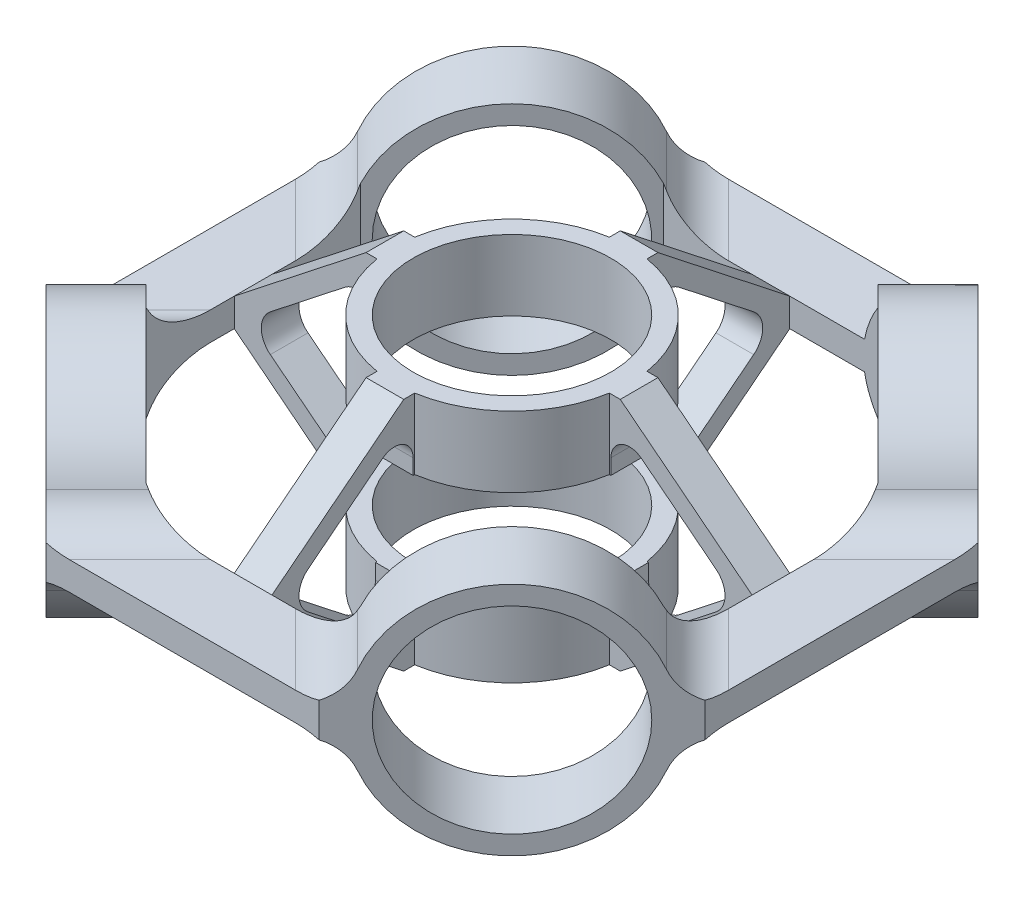
from build123d import *

# Parameters (mm, degrees)
EXTRUDE_START              = 25
SKETCH_1_R                 = 25
SKETCH_1_R_2               = 21
EXTRUDE_1_DEPTH            = 15
EXTRUDE_2_DEPTH            = 3
EXTRUDE_START_2            = -25
SKETCH_1_5_R               = 25
SKETCH_1_5_R_2             = 21
EXTRUDE_7_DEPTH            = 15
SKETCH_5_R                 = 25
SKETCH_5_R_2               = 21
EXTRUDE_9_DEPTH            = 20
SKETCH_5_2_R               = 21
CUT_EXTRUDE_4_DEPTH        = 20
MIRROR_4_COPY_1_SKETCH_R   = 25
MIRROR_4_COPY_1_SKETCH_R_2 = 21
MIRROR_4_COPY_1_DEPTH      = 20
MIRROR_4_COPY_2_SKETCH_R   = 21
MIRROR_4_COPY_2_DEPTH      = 20
FILLET_4_R                 = 10
SKETCH_1_6_R               = 25
CUT_EXTRUDE_5_DEPTH        = 25
EXTRUDE_10_DEPTH           = 4
PATTERN_CIRCULAR_1_COUNT   = 4


with BuildPart() as part:
    # 草图1 → 凸台-拉伸1 (new body)
    with BuildSketch(Plane(origin=(0, 0, 0), x_dir=(1, 0, 0), z_dir=(0, 1, 0)).offset(EXTRUDE_START)):
        with Locations(Location((0, 0, 0), (0, 0, 270))):
            Circle(SKETCH_1_R)
        with Locations(Location((0, 0, 0), (0, 0, 270))):
            Circle(SKETCH_1_R_2, mode=Mode.SUBTRACT)
    extrude(amount=-EXTRUDE_1_DEPTH)



with BuildPart() as body_2:
    # 草图1<3> → 凸台-拉伸2 (new, symmetric)
    with BuildSketch(Plane(origin=(0, 0, 0), x_dir=(1, 0, 0), z_dir=(0, 1, 0))):
        Polygon((-28.994949366, -70), (28.994949366, -70), (70, -28.994949366), (70, 28.994949366), (28.994949366, 70), (-28.994949366, 70), (-70, 28.994949366), (-70, -28.994949366), align=None)
        Polygon((55, 22.781745931), (22.781745931, 55), (-22.781745931, 55), (-55, 22.781745931), (-55, -22.781745931), (-22.781745931, -55), (22.781745931, -55), (55, -22.781745931), align=None, mode=Mode.SUBTRACT)
    extrude(amount=EXTRUDE_2_DEPTH, both=True)

    # 草图5 → 凸台-拉伸9 (add)
    with BuildSketch(Plane(origin=(-49.497474683, 0, -49.497474683), x_dir=(-0.7071067811865477, 0, 0.7071067811865475), z_dir=(-0.7071067811865475, 0, -0.7071067811865477))):
        Circle(SKETCH_5_R)
        Circle(SKETCH_5_R_2, mode=Mode.SUBTRACT)
    extrude_9 = extrude(amount=-EXTRUDE_9_DEPTH)

    # 草图5<2> → 切除-拉伸4 (cut)
    with BuildSketch(Plane(origin=(-49.497474683, 0, -49.497474683), x_dir=(-0.7071067811865477, 0, 0.7071067811865475), z_dir=(-0.7071067811865475, 0, -0.7071067811865477))):
        Circle(SKETCH_5_2_R)
    cut_extrude_4 = extrude(amount=-CUT_EXTRUDE_4_DEPTH, mode=Mode.SUBTRACT)

    # 镜向3: 凸台-拉伸9, 切除-拉伸4 across plane
    add(extrude_9.mirror(Plane.XY))
    add(cut_extrude_4.mirror(Plane.XY), mode=Mode.SUBTRACT)

    # 镜向4: 凸台-拉伸9, 切除-拉伸4 across plane
    add(extrude_9.mirror(Plane(origin=(0, 0, 0), x_dir=(0, 0, 1), z_dir=(1, 0, 0))))
    add(cut_extrude_4.mirror(Plane(origin=(0, 0, 0), x_dir=(0, 0, 1), z_dir=(1, 0, 0))), mode=Mode.SUBTRACT)

    # 镜向4 copy 1 sketch → 镜向4 copy 1 (add)
    with BuildSketch(Plane(origin=(49.497474683, 0, 49.497474683), x_dir=(0.7071067811865477, 0, -0.7071067811865475), z_dir=(0.7071067811865475, 0, 0.7071067811865477))):
        Circle(MIRROR_4_COPY_1_SKETCH_R)
        Circle(MIRROR_4_COPY_1_SKETCH_R_2, mode=Mode.SUBTRACT)
    extrude(amount=-MIRROR_4_COPY_1_DEPTH)

    # 镜向4 copy 2 sketch → 镜向4 copy 2 (cut)
    with BuildSketch(Plane(origin=(49.497474683, 0, 49.497474683), x_dir=(0.7071067811865477, 0, -0.7071067811865475), z_dir=(0.7071067811865475, 0, 0.7071067811865477))):
        Circle(MIRROR_4_COPY_2_SKETCH_R)
    extrude(amount=-MIRROR_4_COPY_2_DEPTH, mode=Mode.SUBTRACT)

    # 圆角4
    # the kernel refuses this fillet: 10 mm, written as the material it adds along each edge
    with BuildSketch(Plane(origin=(-6.329337922, 3, -41.429195472), x_dir=(-0.17522775195055232, 0.9688087891285418, 0.17522775195055224), z_dir=(-0.7071067811865475, 0, -0.7071067811865477))) as fillet_4_piece_1_section:
        with BuildLine():
            CenterArc((7.785702636, 9.915452075), FILLET_4_R, 194.347925284, 68.196252011)
            Line((-1.902385256, 7.437357442), (0, 0))
            ThreePointArc((0, 0), (3.244042765, 0.211369813), (6.48808553, 0))
        make_face()
    fillet_4_piece_1 = extrude(amount=36.229617178, mode=Mode.PRIVATE)
    fillet_4_piece_1 = split(fillet_4_piece_1, bisect_by=Plane(origin=(-13.032672025, 3.061224537, -55), z_dir=(0, 0, -1)), keep=Keep.TOP, mode=Mode.PRIVATE)
    fillet_4_piece_1 = split(fillet_4_piece_1, bisect_by=Plane(origin=(-13.032672025, 3.061224537, -70), z_dir=(0, 0, 1)), keep=Keep.TOP, mode=Mode.PRIVATE)
    add(fillet_4_piece_1)
    with BuildSketch(Plane(origin=(-6.329337922, -3, -41.429195472), x_dir=(-0.17522775195055199, -0.968808789128542, 0.17522775195055193), z_dir=(-0.7071067811865475, 0, -0.7071067811865477))) as fillet_4_piece_2_section:
        with BuildLine():
            CenterArc((7.785702636, -9.915452075), FILLET_4_R, 97.455822705, 68.196252011)
            Line((-1.902385256, -7.437357442), (0, 0))
            ThreePointArc((0, 0), (3.244042765, -0.211369813), (6.48808553, 0))
        make_face()
    fillet_4_piece_2 = extrude(amount=36.229617178, mode=Mode.PRIVATE)
    fillet_4_piece_2 = split(fillet_4_piece_2, bisect_by=Plane(origin=(-13.032672025, -3.061224537, -55), z_dir=(0, 0, -1)), keep=Keep.TOP, mode=Mode.PRIVATE)
    fillet_4_piece_2 = split(fillet_4_piece_2, bisect_by=Plane(origin=(-13.032672025, -3.061224537, -70), z_dir=(0, 0, 1)), keep=Keep.TOP, mode=Mode.PRIVATE)
    add(fillet_4_piece_2)
    with BuildSketch(Plane(origin=(-41.429195472, -3, -6.329337922), x_dir=(-0.7071067811865476, 0, 0.7071067811865475), z_dir=(-0.7071067811865475, 0, -0.7071067811865477))) as fillet_4_piece_3_section:
        with BuildLine():
            CenterArc((7.676806327, -10), FILLET_4_R, 90, 68.196252011)
            ThreePointArc((-1.607808993, -6.285714286), (-0.599127564, -3.195236583), (0, 0))
            Line((0, 0), (7.676806327, 0))
        make_face()
    fillet_4_piece_3 = extrude(amount=36.229617178, mode=Mode.PRIVATE)
    fillet_4_piece_3 = split(fillet_4_piece_3, bisect_by=Plane(origin=(-70, -3.061224537, -13.032672026), z_dir=(1, 0, 0)), keep=Keep.TOP, mode=Mode.PRIVATE)
    fillet_4_piece_3 = split(fillet_4_piece_3, bisect_by=Plane(origin=(-55, -3.061224537, -13.032672026), z_dir=(-1, 0, 0)), keep=Keep.TOP, mode=Mode.PRIVATE)
    add(fillet_4_piece_3)
    with BuildSketch(Plane(origin=(-41.429195472, 3, -6.329337922), x_dir=(0.17522775195055176, 0.9688087891285421, -0.17522775195055168), z_dir=(-0.7071067811865475, 0, -0.7071067811865477))) as fillet_4_piece_4_section:
        with BuildLine():
            CenterArc((7.785702636, -9.915452075), FILLET_4_R, 97.455822705, 68.196252011)
            Line((-1.902385256, -7.437357442), (0, 0))
            ThreePointArc((0, 0), (3.244042765, -0.211369813), (6.48808553, 0))
        make_face()
    fillet_4_piece_4 = extrude(amount=36.229617178, mode=Mode.PRIVATE)
    fillet_4_piece_4 = split(fillet_4_piece_4, bisect_by=Plane(origin=(-55, 3.061224537, -13.032672025), z_dir=(-1, 0, 0)), keep=Keep.TOP, mode=Mode.PRIVATE)
    fillet_4_piece_4 = split(fillet_4_piece_4, bisect_by=Plane(origin=(-70, 3.061224537, -13.032672025), z_dir=(1, 0, 0)), keep=Keep.TOP, mode=Mode.PRIVATE)
    add(fillet_4_piece_4)
    with BuildSketch(Plane(origin=(41.429195472, -3, -6.329337922), x_dir=(0.7071067811865476, 0, 0.7071067811865475), z_dir=(0.7071067811865475, 0, -0.7071067811865477))) as fillet_4_piece_5_section:
        with BuildLine():
            CenterArc((7.676806327, 10), FILLET_4_R, 201.803747989, 68.196252011)
            ThreePointArc((-1.607808993, 6.285714286), (-0.599127564, 3.195236583), (0, 0))
            Line((0, 0), (7.676806327, 0))
        make_face()
    fillet_4_piece_5 = extrude(amount=36.229617178, mode=Mode.PRIVATE)
    fillet_4_piece_5 = split(fillet_4_piece_5, bisect_by=Plane(origin=(55, -3.061224537, -13.032672026), z_dir=(1, 0, 0)), keep=Keep.TOP, mode=Mode.PRIVATE)
    fillet_4_piece_5 = split(fillet_4_piece_5, bisect_by=Plane(origin=(70, -3.061224537, -13.032672026), z_dir=(-1, 0, 0)), keep=Keep.TOP, mode=Mode.PRIVATE)
    add(fillet_4_piece_5)
    with BuildSketch(Plane(origin=(41.429195472, 3, -6.329337922), x_dir=(0.7071067811865477, 0, 0.7071067811865474), z_dir=(0.7071067811865475, 0, -0.7071067811865477))) as fillet_4_piece_6_section:
        with BuildLine():
            CenterArc((7.676806327, -10), FILLET_4_R, 90, 68.196252011)
            ThreePointArc((-1.607808993, -6.285714286), (-0.599127564, -3.195236583), (0, 0))
            Line((0, 0), (7.676806327, 0))
        make_face()
    fillet_4_piece_6 = extrude(amount=36.229617178, mode=Mode.PRIVATE)
    fillet_4_piece_6 = split(fillet_4_piece_6, bisect_by=Plane(origin=(55, 3.061224537, -13.032672026), z_dir=(1, 0, 0)), keep=Keep.TOP, mode=Mode.PRIVATE)
    fillet_4_piece_6 = split(fillet_4_piece_6, bisect_by=Plane(origin=(70, 3.061224537, -13.032672026), z_dir=(-1, 0, 0)), keep=Keep.TOP, mode=Mode.PRIVATE)
    add(fillet_4_piece_6)
    with BuildSketch(Plane(origin=(41.429195472, -3, 6.329337922), x_dir=(-0.17522775195055218, -0.9688087891285418, 0.17522775195055212), z_dir=(0.7071067811865475, 0, 0.7071067811865477))) as fillet_4_piece_7_section:
        with BuildLine():
            CenterArc((7.785702636, 9.915452075), FILLET_4_R, 194.347925284, 68.196252011)
            Line((-1.902385256, 7.437357442), (0, 0))
            ThreePointArc((0, 0), (3.244042765, 0.211369813), (6.48808553, 0))
        make_face()
    fillet_4_piece_7 = extrude(amount=36.229617178, mode=Mode.PRIVATE)
    fillet_4_piece_7 = split(fillet_4_piece_7, bisect_by=Plane(origin=(55, -3.061224537, 13.032672025), z_dir=(1, 0, 0)), keep=Keep.TOP, mode=Mode.PRIVATE)
    fillet_4_piece_7 = split(fillet_4_piece_7, bisect_by=Plane(origin=(70, -3.061224537, 13.032672025), z_dir=(-1, 0, 0)), keep=Keep.TOP, mode=Mode.PRIVATE)
    add(fillet_4_piece_7)
    with BuildSketch(Plane(origin=(41.429195472, 3, 6.329337922), x_dir=(0.7071067811865476, 0, -0.7071067811865474), z_dir=(0.7071067811865475, 0, 0.7071067811865477))) as fillet_4_piece_8_section:
        with BuildLine():
            CenterArc((7.676806327, 10), FILLET_4_R, 201.803747989, 68.196252011)
            ThreePointArc((-1.607808993, 6.285714286), (-0.599127564, 3.195236583), (0, 0))
            Line((0, 0), (7.676806327, 0))
        make_face()
    fillet_4_piece_8 = extrude(amount=36.229617178, mode=Mode.PRIVATE)
    fillet_4_piece_8 = split(fillet_4_piece_8, bisect_by=Plane(origin=(55, 3.061224537, 13.032672026), z_dir=(1, 0, 0)), keep=Keep.TOP, mode=Mode.PRIVATE)
    fillet_4_piece_8 = split(fillet_4_piece_8, bisect_by=Plane(origin=(70, 3.061224537, 13.032672026), z_dir=(-1, 0, 0)), keep=Keep.TOP, mode=Mode.PRIVATE)
    add(fillet_4_piece_8)
    with BuildSketch(Plane(origin=(6.329337922, 3, 41.429195472), x_dir=(0.17522775195055232, 0.9688087891285418, -0.17522775195055224), z_dir=(0.7071067811865475, 0, 0.7071067811865477))) as fillet_4_piece_9_section:
        with BuildLine():
            CenterArc((7.785702636, 9.915452075), FILLET_4_R, 194.347925284, 68.196252011)
            Line((-1.902385256, 7.437357442), (0, 0))
            ThreePointArc((0, 0), (3.244042765, 0.211369813), (6.48808553, 0))
        make_face()
    fillet_4_piece_9 = extrude(amount=36.229617178, mode=Mode.PRIVATE)
    fillet_4_piece_9 = split(fillet_4_piece_9, bisect_by=Plane(origin=(13.032672025, 3.061224537, 70), z_dir=(0, 0, -1)), keep=Keep.TOP, mode=Mode.PRIVATE)
    fillet_4_piece_9 = split(fillet_4_piece_9, bisect_by=Plane(origin=(13.032672025, 3.061224537, 55), z_dir=(0, 0, 1)), keep=Keep.TOP, mode=Mode.PRIVATE)
    add(fillet_4_piece_9)
    with BuildSketch(Plane(origin=(6.329337922, -3, 41.429195472), x_dir=(0.17522775195055199, -0.968808789128542, -0.17522775195055193), z_dir=(0.7071067811865475, 0, 0.7071067811865477))) as fillet_4_piece_10_section:
        with BuildLine():
            CenterArc((7.785702636, -9.915452075), FILLET_4_R, 97.455822705, 68.196252011)
            Line((-1.902385256, -7.437357442), (0, 0))
            ThreePointArc((0, 0), (3.244042765, -0.211369813), (6.48808553, 0))
        make_face()
    fillet_4_piece_10 = extrude(amount=36.229617178, mode=Mode.PRIVATE)
    fillet_4_piece_10 = split(fillet_4_piece_10, bisect_by=Plane(origin=(13.032672025, -3.061224537, 70), z_dir=(0, 0, -1)), keep=Keep.TOP, mode=Mode.PRIVATE)
    fillet_4_piece_10 = split(fillet_4_piece_10, bisect_by=Plane(origin=(13.032672025, -3.061224537, 55), z_dir=(0, 0, 1)), keep=Keep.TOP, mode=Mode.PRIVATE)
    add(fillet_4_piece_10)
    with BuildSketch(Plane(origin=(-6.329337922, -3, 41.429195472), x_dir=(-0.17522775195055199, -0.968808789128542, -0.17522775195055193), z_dir=(-0.7071067811865475, 0, 0.7071067811865477))) as fillet_4_piece_11_section:
        with BuildLine():
            CenterArc((7.785702636, 9.915452075), FILLET_4_R, 194.347925284, 68.196252011)
            Line((-1.902385256, 7.437357442), (0, 0))
            ThreePointArc((0, 0), (3.244042765, 0.211369813), (6.48808553, 0))
        make_face()
    fillet_4_piece_11 = extrude(amount=36.229617178, mode=Mode.PRIVATE)
    fillet_4_piece_11 = split(fillet_4_piece_11, bisect_by=Plane(origin=(-13.032672025, -3.061224537, 70), z_dir=(0, 0, -1)), keep=Keep.TOP, mode=Mode.PRIVATE)
    fillet_4_piece_11 = split(fillet_4_piece_11, bisect_by=Plane(origin=(-13.032672025, -3.061224537, 55), z_dir=(0, 0, 1)), keep=Keep.TOP, mode=Mode.PRIVATE)
    add(fillet_4_piece_11)
    with BuildSketch(Plane(origin=(-6.329337922, 3, 41.429195472), x_dir=(-0.17522775195055232, 0.9688087891285418, -0.17522775195055224), z_dir=(-0.7071067811865475, 0, 0.7071067811865477))) as fillet_4_piece_12_section:
        with BuildLine():
            CenterArc((7.785702636, -9.915452075), FILLET_4_R, 97.455822705, 68.196252011)
            Line((-1.902385256, -7.437357442), (0, 0))
            ThreePointArc((0, 0), (3.244042765, -0.211369813), (6.48808553, 0))
        make_face()
    fillet_4_piece_12 = extrude(amount=36.229617178, mode=Mode.PRIVATE)
    fillet_4_piece_12 = split(fillet_4_piece_12, bisect_by=Plane(origin=(-13.032672025, 3.061224537, 70), z_dir=(0, 0, -1)), keep=Keep.TOP, mode=Mode.PRIVATE)
    fillet_4_piece_12 = split(fillet_4_piece_12, bisect_by=Plane(origin=(-13.032672025, 3.061224537, 55), z_dir=(0, 0, 1)), keep=Keep.TOP, mode=Mode.PRIVATE)
    add(fillet_4_piece_12)
    with BuildSketch(Plane(origin=(-41.429195472, -3, 6.329337922), x_dir=(-0.7071067811865477, 0, -0.7071067811865475), z_dir=(-0.7071067811865475, 0, 0.7071067811865477))) as fillet_4_piece_13_section:
        with BuildLine():
            CenterArc((7.676806327, 10), FILLET_4_R, 201.803747989, 68.196252011)
            ThreePointArc((-1.607808993, 6.285714286), (-0.599127564, 3.195236583), (0, 0))
            Line((0, 0), (7.676806327, 0))
        make_face()
    fillet_4_piece_13 = extrude(amount=36.229617178, mode=Mode.PRIVATE)
    fillet_4_piece_13 = split(fillet_4_piece_13, bisect_by=Plane(origin=(-70, -3.061224537, 13.032672026), z_dir=(1, 0, 0)), keep=Keep.TOP, mode=Mode.PRIVATE)
    fillet_4_piece_13 = split(fillet_4_piece_13, bisect_by=Plane(origin=(-55, -3.061224537, 13.032672026), z_dir=(-1, 0, 0)), keep=Keep.TOP, mode=Mode.PRIVATE)
    add(fillet_4_piece_13)
    with BuildSketch(Plane(origin=(-41.429195472, 3, 6.329337922), x_dir=(-0.7071067811865476, 0, -0.7071067811865475), z_dir=(-0.7071067811865475, 0, 0.7071067811865477))) as fillet_4_piece_14_section:
        with BuildLine():
            CenterArc((7.676806327, -10), FILLET_4_R, 90, 68.196252011)
            ThreePointArc((-1.607808993, -6.285714286), (-0.599127564, -3.195236583), (0, 0))
            Line((0, 0), (7.676806327, 0))
        make_face()
    fillet_4_piece_14 = extrude(amount=36.229617178, mode=Mode.PRIVATE)
    fillet_4_piece_14 = split(fillet_4_piece_14, bisect_by=Plane(origin=(-55, 3.061224537, 13.032672026), z_dir=(-1, 0, 0)), keep=Keep.TOP, mode=Mode.PRIVATE)
    fillet_4_piece_14 = split(fillet_4_piece_14, bisect_by=Plane(origin=(-70, 3.061224537, 13.032672026), z_dir=(1, 0, 0)), keep=Keep.TOP, mode=Mode.PRIVATE)
    add(fillet_4_piece_14)

    # 草图1<6> → 切除-拉伸5 (cut, symmetric)
    with BuildSketch(Plane(origin=(0, 0, 0), x_dir=(1, 0, 0), z_dir=(0, 1, 0))):
        Polygon((55, -22.781745931), (55, 22.781745931), (22.781745931, 55), (-22.781745931, 55), (-55, 22.781745931), (-55, -22.781745931), (-22.781745931, -55), (22.781745931, -55), align=None)
        with Locations(Location((0, 0, 0), (0, 0, 270))):
            Circle(SKETCH_1_6_R, mode=Mode.SUBTRACT)
    extrude(amount=CUT_EXTRUDE_5_DEPTH, both=True, mode=Mode.SUBTRACT)


with BuildPart() as body_3:
    # 草图1<5> → 凸台-拉伸7 (new body)
    with BuildSketch(Plane(origin=(0, 0, 0), x_dir=(1, 0, 0), z_dir=(0, 1, 0)).offset(EXTRUDE_START_2)):
        with Locations(Location((0, 0, 0), (0, 0, 270))):
            Circle(SKETCH_1_5_R)
        with Locations(Location((0, 0, 0), (0, 0, 270))):
            Circle(SKETCH_1_5_R_2, mode=Mode.SUBTRACT)
    extrude(amount=EXTRUDE_7_DEPTH)


with BuildPart() as part_1:
    add(part.part)

    add(body_2.part)  # 凸台-拉伸10 merges body 2

    add(body_3.part)  # 凸台-拉伸10 merges body 3
    # 草图7 → 凸台-拉伸10 (add, symmetric)
    with BuildSketch(Plane.XY):
        with BuildLine():
            Line((22.5, 25), (27, 25))
            Line((27, 25), (55, 3))
            Line((55, 3), (55, -3))
            Line((55, -3), (27, -25))
            Line((27, -25), (22.5, -25))
            Line((22.5, -25), (22.5, -10))
            Line((22.5, -10), (25, -10))
            Line((25, -10), (25, -13.254574963))
            ThreePointArc((25, -13.254574963), (27.251449862, -16.852153651), (31.471286208, -16.399848318))
            Line((31.471286208, -16.399848318), (47.339976457, -3.931591694))
            ThreePointArc((47.339976457, -3.931591694), (49.250868697, 0), (47.339976457, 3.931591694))
            Line((47.339976457, 3.931591694), (31.471286208, 16.399848318))
            ThreePointArc((31.471286208, 16.399848318), (27.251449862, 16.852153651), (25, 13.254574963))
            Line((25, 13.254574963), (25, 10))
            Line((25, 10), (22.5, 10))
            Line((22.5, 10), (22.5, 25))
        make_face()
    extrude_10 = extrude(amount=EXTRUDE_10_DEPTH, both=True)

    # 阵列(圆周)1: 凸台-拉伸10 ×4 about axis
    pattern_circular_1_axis = Axis((0, 0, 0), (0, 1, 0))
    for i in range(1, PATTERN_CIRCULAR_1_COUNT):
        add(extrude_10.rotate(pattern_circular_1_axis, i * 360 / PATTERN_CIRCULAR_1_COUNT))


solid = part_1.part
